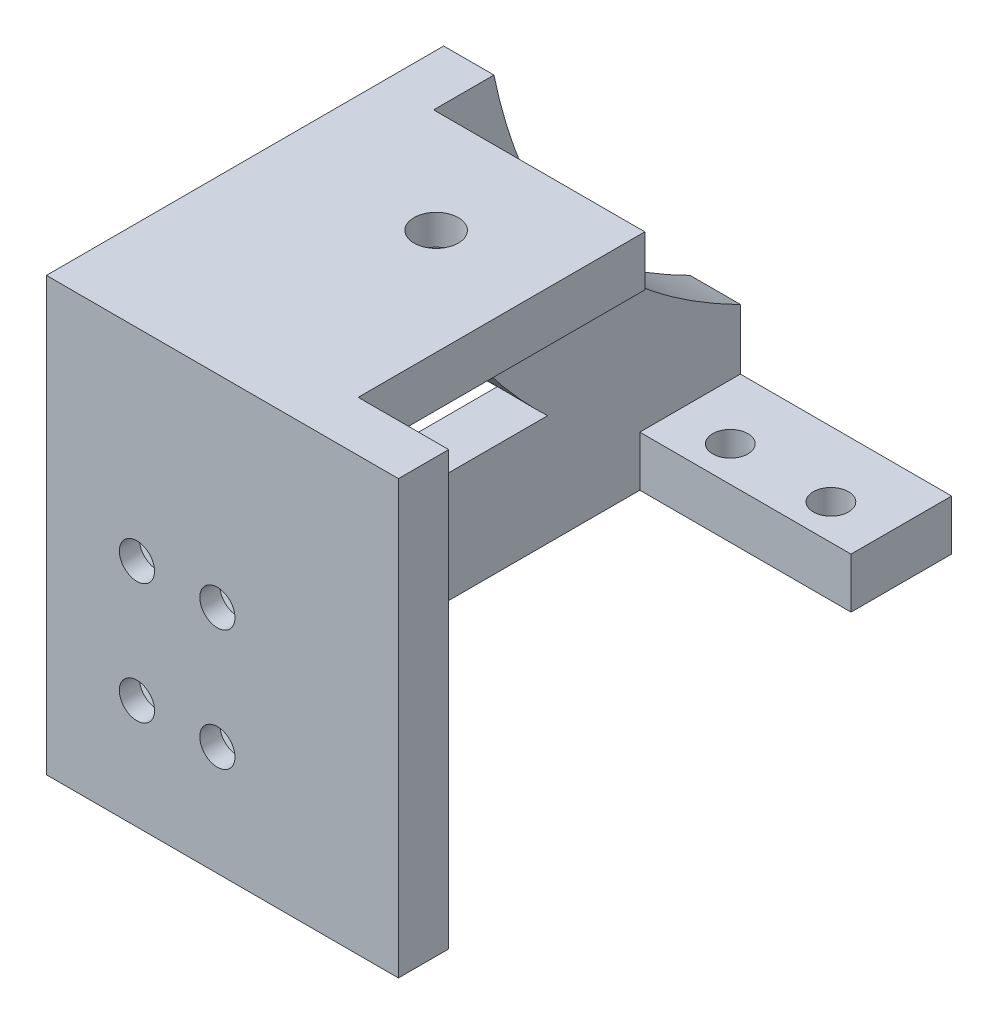
from build123d import *

# Parameters (mm, degrees)
SKETCH1_W               = 35
SKETCH1_H               = 43
BOSS_EXTRUDE1_DEPTH     = 64
CUT_EXTRUDE1_DEPTH      = 77.04768241
CUT_EXTRUDE1_DEPTH_BACK = 77.04768241
CUT_EXTRUDE2_START      = -9
CUT_EXTRUDE2_DEPTH      = 9
CUT_EXTRUDE3_START      = -21
CUT_EXTRUDE3_DEPTH      = 21
SKETCH5_R               = 1.75
CUT_EXTRUDE4_DEPTH      = 21
CUT_EXTRUDE5_DEPTH      = 3
SKETCH7_R               = 1.75
CUT_EXTRUDE6_DEPTH      = 3
CUT_EXTRUDE7_DEPTH      = 2
SKETCH9_R               = 2.2
CUT_EXTRUDE8_DEPTH      = 78.474189407


# Read off the part's stored shape, not the designer's step: Cut-Extrude2, Cut-Extrude3
with BuildPart() as part:
    # Sketch1 → Boss-Extrude1 (new body)
    with BuildSketch(Plane.XY):
        Rectangle(SKETCH1_W, SKETCH1_H)
    extrude(amount=BOSS_EXTRUDE1_DEPTH)

    # Sketch2 → Cut-Extrude1 (cut, two sides: drawn at the far end of the back side and taken through both)
    with BuildSketch(Plane.ZY.offset(17.5).offset(-CUT_EXTRUDE1_DEPTH_BACK)):
        with BuildLine():
            Line((33.173885888, 11.5), (52, 11.5))
            Line((52, 11.5), (52, -10.5))
            Line((52, -10.5), (19.162446424, -10.499999995))
            add(Edge.make_bspline(
                [(19.162446424, -10.499999995), (20.832699675, -8.924322211), (23.191334331, -6.393604558), (26.156205176, -2.504954915), (28.325520723, 0.825456595), (30.873918563, 5.512287152), (32.363699443, 9.120198936), (33.173885888, 11.5)],
                knots=[0, 0, 0, 0, 0.261534973, 0.392989592, 0.556559744, 0.713681498, 1, 1, 1, 1], degree=3))
        make_face()
        with BuildLine():
            Line((0, -10.5), (0, 21.5))
            Line((0, 21.5), (24.5, 21.5))
            add(Edge.make_bspline(
                [(0, -10.5), (1.410254908, -9.794803553), (3.993077245, -8.365634948), (7.472082945, -6.021166025), (11.139491519, -3.071889035), (14.560754773, 0.394143772), (17.949614827, 4.871331165), (20.454917465, 9.23876326), (22.857889337, 14.900225374), (23.971477933, 18.909511405), (24.5, 21.5)],
                knots=[0, 0, 0, 0, 0.113112972, 0.211522862, 0.300551396, 0.450408793, 0.559434529, 0.702650577, 0.810275993, 1, 1, 1, 1], degree=3))
        make_face()
    extrude(amount=CUT_EXTRUDE1_DEPTH + CUT_EXTRUDE1_DEPTH_BACK, mode=Mode.SUBTRACT)

    # Cut-Extrude2 outline → Cut-Extrude2 (cut)
    with BuildSketch(Plane(origin=(17.5, 0, 0), x_dir=(0, 0, -1), z_dir=(1, 0, 0)).offset(CUT_EXTRUDE2_START)):
        with BuildLine():
            Line((-24.5, 21.5), (-59, 21.5))
            Line((-59, 21.5), (-59, -21.5))
            Line((-59, -21.5), (0, -21.5))
            Line((0, -21.5), (0, -10.5))
            add(Edge.make_bspline(
                [(0, -10.5), (-1.410254908, -9.794803553), (-3.993077245, -8.365634948), (-7.472082945, -6.021166025), (-11.139491519, -3.071889035), (-14.560754773, 0.394143772), (-17.949614827, 4.871331165), (-20.454917465, 9.23876326), (-22.857889337, 14.900225374), (-23.971477933, 18.909511405), (-24.5, 21.5)],
                knots=[0, 0, 0, 0, 0.113112972, 0.211522862, 0.300551396, 0.450408793, 0.559434529, 0.702650577, 0.810275993, 1, 1, 1, 1], degree=3))
        make_face()
        with BuildLine():
            Line((-52, 11.5), (-33.173885888, 11.5))
            add(Edge.make_bspline(
                [(-33.173885888, 11.5), (-32.363699443, 9.120198936), (-30.873918563, 5.512287152), (-28.325520723, 0.825456595), (-26.156205176, -2.504954915), (-23.191334331, -6.393604558), (-20.832699675, -8.924322211), (-19.162446424, -10.499999995)],
                knots=[0, 0, 0, 0, 0.286318502, 0.443440256, 0.607010408, 0.738465027, 1, 1, 1, 1], degree=3))
            Line((-19.162446424, -10.499999995), (-52, -10.5))
            Line((-52, -10.5), (-52, 11.5))
        make_face(mode=Mode.SUBTRACT)
    extrude(amount=CUT_EXTRUDE2_DEPTH, mode=Mode.SUBTRACT)

    # Cut-Extrude3 outline → Cut-Extrude3 (cut)
    with BuildSketch(Plane(origin=(8.5, 0, 0), x_dir=(0, 0, -1), z_dir=(1, 0, 0)).offset(CUT_EXTRUDE3_START)):
        with BuildLine():
            Line((-30.5, 16.5), (-59, 16.5))
            Line((-59, 16.5), (-59, -16.5))
            Line((-59, -16.5), (-51, -16.5))
            Line((-51, -16.5), (-51, -21.5))
            Line((-51, -21.5), (-10, -21.5))
            Line((-10, -21.5), (-10, -16.5))
            Line((-10, -16.5), (0, -16.5))
            Line((0, -16.5), (0, -10.5))
            add(Edge.make_bspline(
                [(0, -10.5), (-1.410254908, -9.794803553), (-3.993077245, -8.365634948), (-7.472082945, -6.021166025), (-11.139491519, -3.071889035), (-14.560754773, 0.394143772), (-17.949614827, 4.871331165), (-20.454917465, 9.23876326), (-22.857889337, 14.900225374), (-23.971477933, 18.909511405), (-24.5, 21.5)],
                knots=[0, 0, 0, 0, 0.113112972, 0.211522862, 0.300551396, 0.450408793, 0.559434529, 0.702650577, 0.810275993, 1, 1, 1, 1], degree=3))
            Line((-24.5, 21.5), (-30.5, 21.5))
            Line((-30.5, 21.5), (-30.5, 16.5))
        make_face()
        with BuildLine():
            Line((-52, 11.5), (-33.173885888, 11.5))
            add(Edge.make_bspline(
                [(-33.173885888, 11.5), (-32.363699443, 9.120198936), (-30.873918563, 5.512287152), (-28.325520723, 0.825456595), (-26.156205176, -2.504954915), (-23.191334331, -6.393604558), (-20.832699675, -8.924322211), (-19.162446424, -10.499999995)],
                knots=[0, 0, 0, 0, 0.286318502, 0.443440256, 0.607010408, 0.738465027, 1, 1, 1, 1], degree=3))
            Line((-19.162446424, -10.499999995), (-52, -10.5))
            Line((-52, -10.5), (-52, 11.5))
        make_face(mode=Mode.SUBTRACT)
    extrude(amount=CUT_EXTRUDE3_DEPTH, mode=Mode.SUBTRACT)

    # Sketch5 → Cut-Extrude4 (cut)
    with BuildSketch(Plane.XZ.offset(21.5)):
        with Locations(Location((3, 54.5, 0), (0, 0, 270))):
            Circle(SKETCH5_R)
        with Locations(Location((-7, 54.5, 0), (0, 0, 270))):
            Circle(SKETCH5_R)
        with Locations(Location((-7, 6.5, 0), (0, 0, 270))):
            Circle(SKETCH5_R)
        with Locations(Location((3, 6.5, 0), (0, 0, 270))):
            Circle(SKETCH5_R)
    extrude(amount=-CUT_EXTRUDE4_DEPTH, mode=Mode.SUBTRACT)

    # Sketch6 → Cut-Extrude5 (cut)
    with BuildSketch(Plane(origin=(0, 0, 59), x_dir=(-1, 0, 0), z_dir=(0, 0, -1))):
        Polygon((0.5, 5.095041723), (-2.7, 3.247520861), (-2.7, -0.447520861), (0.5, -2.295041723), (3.7, -0.447520861), (3.7, 3.247520861), align=None)
        Polygon((8.5, 5.095041723), (5.3, 3.247520861), (5.3, -0.447520861), (8.5, -2.295041723), (11.7, -0.447520861), (11.7, 3.247520861), align=None)
        Polygon((8.5, -6.904958277), (5.3, -8.752479139), (5.3, -12.447520861), (8.5, -14.295041723), (11.7, -12.447520861), (11.7, -8.752479139), align=None)
        Polygon((0.5, -6.904958277), (-2.7, -8.752479139), (-2.7, -12.447520861), (0.5, -14.295041723), (3.7, -12.447520861), (3.7, -8.752479139), align=None)
    extrude(amount=-CUT_EXTRUDE5_DEPTH, mode=Mode.SUBTRACT)

    # Sketch7 → Cut-Extrude6 (cut)
    with BuildSketch(Plane(origin=(0, 0, 62), x_dir=(-1, 0, 0), z_dir=(0, 0, -1))):
        with Locations((0.5, 1.4)):
            Circle(SKETCH7_R)
        with Locations((8.5, 1.4)):
            Circle(SKETCH7_R)
        with Locations((8.5, -10.6)):
            Circle(SKETCH7_R)
        with Locations((0.5, -10.6)):
            Circle(SKETCH7_R)
    extrude(amount=-CUT_EXTRUDE6_DEPTH, mode=Mode.SUBTRACT)

    # Sketch8 → Cut-Extrude7 (cut)
    with BuildSketch(Plane.XZ.offset(-16.5)):
        Polygon((1.7, 38.613804004), (1.7, 42.886195996), (-2, 45.022391992), (-5.7, 42.886195996), (-5.7, 38.613804004), (-2, 36.477608008), align=None)
    extrude(amount=-CUT_EXTRUDE7_DEPTH, mode=Mode.SUBTRACT)

    # Sketch9 → Cut-Extrude8 (cut, through all)
    with BuildSketch(Plane(origin=(0, 18.5, 0), x_dir=(-1, 0, 0), z_dir=(0, -1, 0))):
        with Locations(Location((2, -40.75, 0), (0, 0, 90))):
            Circle(SKETCH9_R)
    extrude(amount=-CUT_EXTRUDE8_DEPTH, mode=Mode.SUBTRACT)


solid = part.part
